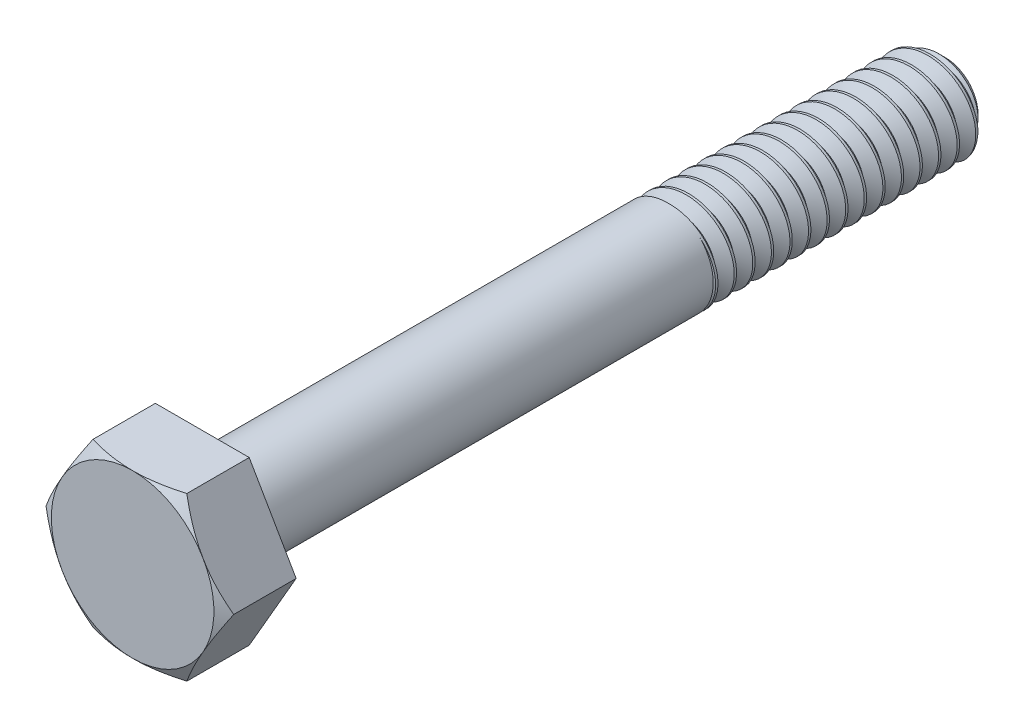
from build123d import *

# Parameters (mm, degrees)
BOSS_EXTRUDE1_DEPTH = 4.7625
SKETCH5_OUTSIDE_W   = 224.622
SKETCH5_OUTSIDE_H   = 222.902
SKETCH5_OUTSIDE_R   = 5.55625
CUT_EXTRUDE1_DEPTH  = 57.206991312
CUT_EXTRUDE1_DRAFT  = -60
CHAMFER1_SIZE       = 0.127
CUT_SWEEP2_PITCH    = 1.27
CUT_SWEEP2_TO       = 19.05


with BuildPart() as part:
    # Sketch3 → Revolve1 (revolve)
    with BuildSketch(Plane(origin=(0, 0, 0), x_dir=(0, 0, -1), z_dir=(1, 0, 0)), mode=Mode.PRIVATE) as revolve1_sk:
        Polygon((-27.78125, 0), (-27.78125, 5.55625), (-23.01875, 5.55625), (-23.01875, 3.175), (26.82875, 3.175), (27.78125, 2.2225), (27.78125, 0), align=None)
    revolve(revolve1_sk.sketch.rotate(Axis((0, 0, -27.78125), (0, 0, 1)), 90), axis=Axis((0, 0, -27.78125), (0, 0, 1)))

    # Sketch4 → Boss-Extrude1 (add)
    with BuildSketch(Plane.XY.offset(27.78125)):
        Polygon((6.415804866, 0), (3.207902433, 5.55625), (-3.207902433, 5.55625), (-6.415804866, 0), (-3.207902433, -5.55625), (3.207902433, -5.55625), align=None)
    extrude(amount=-BOSS_EXTRUDE1_DEPTH)


with BuildPart() as cut_extrude1_tool:
    # Sketch5 outside → Cut-Extrude1 (with draft: the straight prism first)
    with BuildSketch(Plane.XY.offset(27.78125)):
        Rectangle(SKETCH5_OUTSIDE_W, SKETCH5_OUTSIDE_H)
        Circle(SKETCH5_OUTSIDE_R, mode=Mode.SUBTRACT)
    extrude(amount=-CUT_EXTRUDE1_DEPTH)
    # Cut-Extrude1: the draft: its side faces are tilted about the plane it starts from
    cut_extrude1_sides = [cut_extrude1_tool.faces().sort_by_distance(p)[0] for p in [
        (0, -111.451, -0.822245656),
        (112.311, 0, -0.822245656),
        (0, 111.451, -0.822245656),
        (-112.311, 0, -0.822245656),
        (-5.55625, 0, -0.822245656),
    ]]
    draft(cut_extrude1_sides, Plane.XY.offset(27.78125), CUT_EXTRUDE1_DRAFT)


with BuildPart() as part_1:
    add(part.part)

    # Cut-Extrude1: cut by cut_extrude1_tool
    add(cut_extrude1_tool.part, mode=Mode.SUBTRACT)

    # Chamfer1
    chamfer1_edges = [part_1.edges().sort_by_distance(p)[0] for p in [
        (3.175, 0, 23.01875),
    ]]
    chamfer(chamfer1_edges, length=CHAMFER1_SIZE)


with BuildPart() as body_2:
    # Split1: the piece on the far side of the plane
    add(part_1.part)
    split(bisect_by=Plane.XY.offset(-8.73125), keep=Keep.BOTTOM)

    # Cut-Sweep2: arcs per turn and ends read off the stored shape
    # Cut-Sweep2: the profile of Sketch7 screwed along a right-hand helix through 17 turns, 8 arcs to a turn; built about Z, then put on its axis
    cut_sweep2_z = Axis((0, 0, 0), (0, 0, 1))
    cut_sweep2_corners = [(3.243740766, 0, 0.0396875), (2.350110803, 0, -0.47625), (2.350110803, 0, -0.635), (3.243740766, 0, -1.1509375)]
    with BuildLine(mode=Mode.PRIVATE) as cut_sweep2_profile:
        Line(cut_sweep2_corners[0], cut_sweep2_corners[1])
        Line(cut_sweep2_corners[1], cut_sweep2_corners[2])
        Line(cut_sweep2_corners[2], cut_sweep2_corners[3])
        Line(cut_sweep2_corners[3], cut_sweep2_corners[0])
    cut_sweep2_cap = Face(cut_sweep2_profile.wire())
    cut_sweep2_turn_angles = [0, 22.5, 45, 67.5, 90, 112.5, 135, 157.5, 180, 202.5, 225, 247.5, 270, 292.5, 315, 337.5, 360]
    cut_sweep2_turn_weights = [1, 0.9238795325112867, 1, 0.9238795325112867, 1, 0.9238795325112867, 1, 0.9238795325112867, 1, 0.9238795325112867, 1, 0.9238795325112867, 1, 0.9238795325112867, 1, 0.9238795325112867, 1]
    cut_sweep2_turn_rails = [Edge.make_bspline([Vector(p[0], p[1], 0).rotate(cut_sweep2_z, cut_sweep2_turn_angles[k]) / cut_sweep2_turn_weights[k] + Vector(0, 0, p[2] + CUT_SWEEP2_PITCH * cut_sweep2_turn_angles[k] / 360) for k in range(17)], [0, 0, 0, 1, 1, 2, 2, 3, 3, 4, 4, 5, 5, 6, 6, 7, 7, 8, 8, 8], 2, cut_sweep2_turn_weights) for p in cut_sweep2_corners]
    cut_sweep2_turn_sides = [Face.make_surface_from_curves(cut_sweep2_turn_rails[p[0]], cut_sweep2_turn_rails[p[1]]) for p in [(0, 1), (1, 2), (2, 3), (3, 0)]]
    cut_sweep2 = Plane(origin=(0, 0, -27.78125), x_dir=(0, 1, 0), z_dir=(0, 0, 1)) * split(Solid(Shell([*[p.moved(Location((0, 0, CUT_SWEEP2_PITCH * i))) for i in range(17) for p in cut_sweep2_turn_sides], cut_sweep2_cap, cut_sweep2_cap.rotate(cut_sweep2_z, 6120).moved(Location((0, 0, CUT_SWEEP2_PITCH * 6120 / 360)))])), bisect_by=Plane.XY.offset(CUT_SWEEP2_TO), keep=Keep.BOTTOM, mode=Mode.PRIVATE)
    add(cut_sweep2, mode=Mode.SUBTRACT)


with BuildPart() as part_2:
    add(part_1.part)

    # Split1
    split(bisect_by=Plane.XY.offset(-8.73125), keep=Keep.TOP)

    add(body_2.part)  # Boss-Extrude2 merges body 2
    # Boss-Extrude2: read off the stored shape, not the designer's step
    # Boss-Extrude2 outline → Boss-Extrude2 (revolve)
    with BuildSketch(Plane.XZ):
        Polygon((2.350104192, -8.73125), (2.350104192, -9.207503817), (3.175, -8.73125), align=None)
    revolve(axis=Axis((0, 0, 0), (0, 0, 1)))


solid = part_2.part
